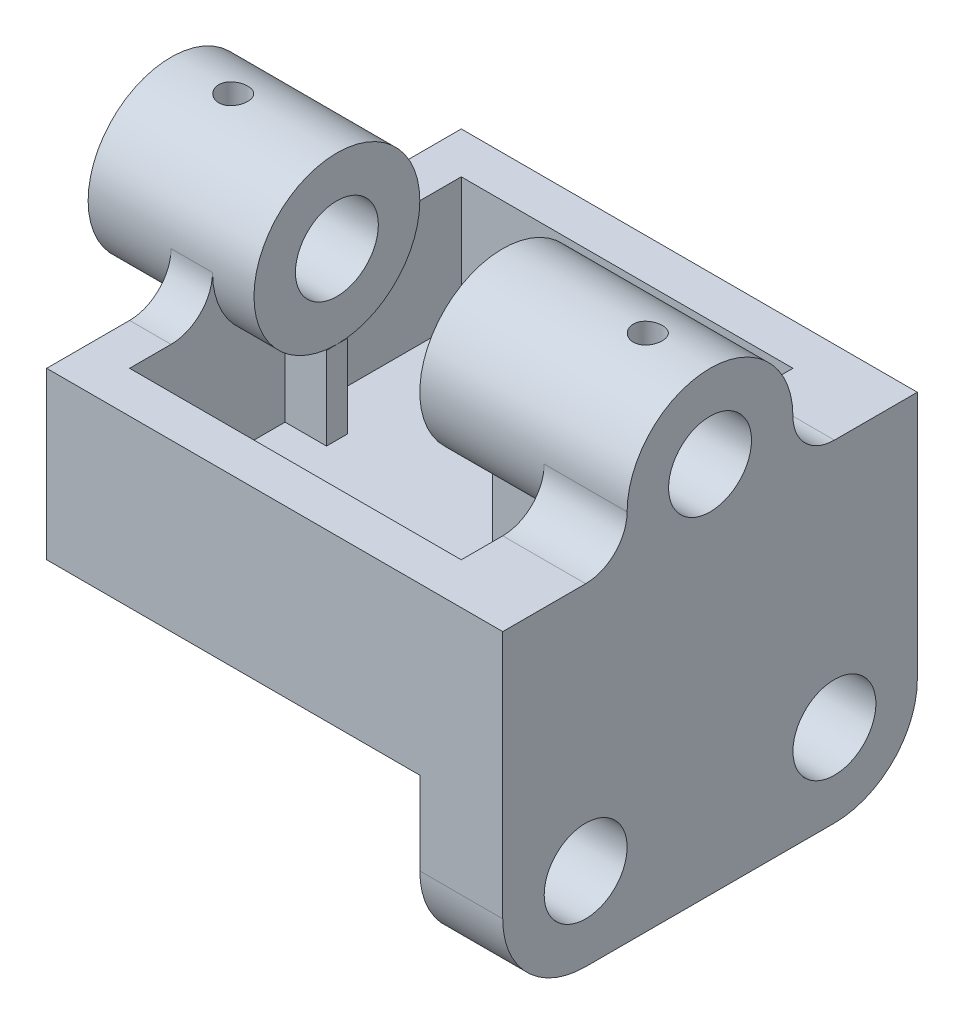
from build123d import *
from build123d.topology import SkipClean

# Parameters (mm, degrees)
SKETCH1_W                = 120
SKETCH1_H                = 100
BOSS_EXTRUDE1_DEPTH      = 100
CUT_EXTRUDE2_DEPTH       = 135
SKETCH3_W                = 20
SKETCH3_H                = 20
CUT_EXTRUDE3_DEPTH       = 135
CUT_EXTRUDE4_DEPTH       = 135
SKETCH5_R                = 20
BOSS_EXTRUDE2_DEPTH      = 120
BOSS_EXTRUDE3_START      = 10
SKETCH6_R                = 20
BOSS_EXTRUDE3_DEPTH      = 10
SKETCH7_R                = 10
CUT_EXTRUDE5_DEPTH       = 40
SKETCH8_R                = 20
CUT_EXTRUDE6_DEPTH       = 40
SKETCH9_R                = 10
CUT_EXTRUDE7_DEPTH       = 76
SKETCH10_R               = 3.5
CUT_EXTRUDE8_DEPTH       = 154
BOSS_EXTRUDE5_DEPTH      = 40
BOSS_EXTRUDE6_START      = -50.0000001
BOSS_EXTRUDE6_DEPTH      = 50.0000001
SKETCH13_R               = 3.5
BOSS_EXTRUDE7_DEPTH      = 50
SKETCH15_R               = 10
CUT_EXTRUDE11_DEPTH      = 152
CUT_EXTRUDE14_DEPTH      = 152
CUT_EXTRUDE14_DEPTH_BACK = 30
SKETCH16_OUTSIDE_W       = 171.496
SKETCH16_OUTSIDE_H       = 141.496
SKETCH16_OUTSIDE_W_2     = 90
SKETCH16_OUTSIDE_H_2     = 80
BOSS_EXTRUDE8_START      = 20
SKETCH17_R               = 20
SKETCH17_R_2             = 10
BOSS_EXTRUDE8_DEPTH      = 20
SKETCH18_R               = 20
SKETCH18_R_2             = 10
BOSS_EXTRUDE9_DEPTH      = 20
SKETCH19_W               = 10
SKETCH19_H               = 30
BOSS_EXTRUDE10_DEPTH     = 90
SKETCH20_W               = 90
SKETCH20_H               = 30
BOSS_EXTRUDE11_DEPTH     = 10
SKETCH22_W               = 100
SKETCH22_H               = 10
CUT_EXTRUDE15_DEPTH      = 10
SKETCH23_W               = 100
SKETCH23_H               = 10
CUT_EXTRUDE16_DEPTH      = 20
CUT_EXTRUDE19_START      = -20
CUT_EXTRUDE19_DEPTH      = 20
SKETCH25_R               = 3.5
CUT_EXTRUDE20_DEPTH      = 220
SKETCH26_R               = 3.5
BOSS_EXTRUDE15_DEPTH     = 85
CUT_EXTRUDE21_START      = 85
CUT_EXTRUDE21_DEPTH      = 85
CUT_EXTRUDE22_DEPTH      = 85
SKETCH30_W               = 90
SKETCH30_H               = 10
CUT_EXTRUDE23_DEPTH      = 85
CUT_EXTRUDE24_START      = -149
SKETCH31_R               = 10
CUT_EXTRUDE24_DEPTH      = 149
SKETCH34_W               = 10
SKETCH34_H               = 39.999
CUT_EXTRUDE33_DEPTH      = 30
SKETCH35_W               = 50
SKETCH35_H               = 10
CUT_EXTRUDE34_DEPTH      = 40
SKETCH36_W               = 112.854184332
SKETCH36_H               = 51.466709558
CUT_EXTRUDE35_DEPTH      = 100
CUT_EXTRUDE36_DEPTH      = 90
BOSS_EXTRUDE16_REACH     = 173.828
SKETCH38_W               = 20
SKETCH38_H               = 40
BOSS_EXTRUDE17_DEPTH     = 20
SKETCH40_W               = 50
SKETCH40_H               = 10
BOSS_EXTRUDE18_DEPTH     = 40
CHAMFER1_SIZE            = 50
CHAMFER1_SIZE_2          = 40
SKETCH41_W               = 10
SKETCH41_H               = 20
BOSS_EXTRUDE21_DEPTH     = 2.5
SKETCH41_W_2             = 30
BOSS_EXTRUDE21_2_DEPTH   = 2.5


with BuildPart() as part:
    # Sketch1 → Boss-Extrude1 (new body)
    with BuildSketch(Plane(origin=(0, 0, 0), x_dir=(1, 0, 0), z_dir=(0, 1, 0))):
        with Locations((60, 50)):
            Rectangle(SKETCH1_W, SKETCH1_H)
    extrude(amount=BOSS_EXTRUDE1_DEPTH)

    # Sketch2 → Cut-Extrude2 (cut)
    with BuildSketch(Plane(origin=(0, 0, 0), x_dir=(0, 0, -1), z_dir=(1, 0, 0))):
        with BuildLine():
            Line((80, 0), (100, 0))
            Line((100, 0), (100, 20))
            ThreePointArc((100, 20), (94.142135624, 5.857864376), (80, 0))
        make_face()
        with BuildLine():
            Line((0, 0), (20, 0))
            ThreePointArc((20, 0), (5.857864376, 5.857864376), (0, 20))
            Line((0, 20), (0, 0))
        make_face()
    extrude(amount=CUT_EXTRUDE2_DEPTH, mode=Mode.SUBTRACT)

    # Sketch3 → Cut-Extrude3 (cut)
    with BuildSketch(Plane.ZY):
        with Locations((-90, 90)):
            Rectangle(SKETCH3_W, SKETCH3_H)
        with Locations((-10, 90)):
            Rectangle(SKETCH3_W, SKETCH3_H)
    extrude(amount=-CUT_EXTRUDE3_DEPTH, mode=Mode.SUBTRACT)

    # Sketch4 → Cut-Extrude4 (cut)
    with BuildSketch(Plane.ZY):
        with BuildLine():
            Line((-80, 100), (-80, 80))
            ThreePointArc((-80, 80), (-72.928932188, 82.928932188), (-70, 90))
            ThreePointArc((-70, 90), (-69.318516526, 95.176380902), (-67.320508076, 100))
            Line((-67.320508076, 100), (-80, 100))
        make_face()
        with BuildLine():
            ThreePointArc((-32.679491924, 100), (-30.681483474, 95.176380902), (-30, 90))
            ThreePointArc((-30, 90), (-27.071067812, 82.928932188), (-20, 80))
            Line((-20, 80), (-20, 100))
            Line((-20, 100), (-32.679491924, 100))
        make_face()
    extrude(amount=-CUT_EXTRUDE4_DEPTH, mode=Mode.SUBTRACT)

    # Sketch5 → Boss-Extrude2 (add)
    with SkipClean():  # the faces are left unmerged after this step: merging them gives an invalid solid
        with BuildSketch(Plane.ZY):
            with Locations((-50, 90)):
                Circle(SKETCH5_R)
        extrude(amount=-BOSS_EXTRUDE2_DEPTH)

    # Sketch6 → Boss-Extrude3 (add)
    with SkipClean():  # the faces are left unmerged after this step: merging them gives an invalid solid
        with BuildSketch(Plane.ZY.offset(BOSS_EXTRUDE3_START)):
            with Locations((-50, 90)):
                Circle(SKETCH6_R)
        extrude(amount=-BOSS_EXTRUDE3_DEPTH)

    # Sketch7 → Cut-Extrude5 (cut)
    with SkipClean():  # the faces are left unmerged after this step: merging them gives an invalid solid
        with BuildSketch(Plane.ZY.offset(10)):
            with Locations((-50, 90)):
                Circle(SKETCH7_R)
        extrude(amount=-CUT_EXTRUDE5_DEPTH, mode=Mode.SUBTRACT)

    # Sketch8 → Cut-Extrude6 (cut)
    with SkipClean():  # the faces are left unmerged after this step: merging them gives an invalid solid
        with BuildSketch(Plane(origin=(30, 0, 0), x_dir=(0, 0, -1), z_dir=(1, 0, 0))):
            with Locations(Location((50, 90, 0), (0, 0, 180))):
                Circle(SKETCH8_R)
        extrude(amount=CUT_EXTRUDE6_DEPTH, mode=Mode.SUBTRACT)

    # Sketch9 → Cut-Extrude7 (cut)
    with SkipClean():  # the faces are left unmerged after this step: merging them gives an invalid solid
        with BuildSketch(Plane.ZY.offset(-70)):
            with Locations((-50, 90)):
                Circle(SKETCH9_R)
        extrude(amount=-CUT_EXTRUDE7_DEPTH, mode=Mode.SUBTRACT)

    # Sketch10 → Cut-Extrude8 (cut)
    with SkipClean():  # the faces are left unmerged after this step: merging them gives an invalid solid
        with BuildSketch(Plane(origin=(0, 0, 0), x_dir=(1, 0, 0), z_dir=(0, 1, 0))):
            with Locations(Location((5, 50, 0), (0, 0, 90))):
                Circle(SKETCH10_R)
            with Locations(Location((105, 50, 0), (0, 0, 90))):
                Circle(SKETCH10_R)
        extrude(amount=CUT_EXTRUDE8_DEPTH, mode=Mode.SUBTRACT)

    # Sketch11 → Boss-Extrude5 (add)
    with SkipClean():  # the faces are left unmerged after this step: merging them gives an invalid solid
        with BuildSketch(Plane.ZY.offset(10)):
            with BuildLine():
                ThreePointArc((-40, 90), (-50, 80), (-60, 90))
                Line((-60, 90), (-70, 90))
                ThreePointArc((-70, 90), (-50, 70), (-30, 90))
                Line((-30, 90), (-40, 90))
            make_face()
        extrude(amount=-BOSS_EXTRUDE5_DEPTH)
    add(part.part.scale(1), mode=Mode.REPLACE)  # the faces are merged on a copy

    # Boss-Extrude6: read off the stored shape, not the designer's step
    # Boss-Extrude6 outline → Boss-Extrude6 (add)
    with BuildSketch(Plane.ZY.offset(-70).offset(BOSS_EXTRUDE6_START)):
        with BuildLine():
            Line((-30, 90), (-40, 90))
            ThreePointArc((-40, 90), (-50, 80), (-60, 90))
            Line((-60, 90), (-70, 90))
            ThreePointArc((-70, 90), (-65.329710362, 77.154768192), (-53.500001979, 70.308631684))
            ThreePointArc((-53.500001979, 70.308631684), (-49.999509114, 70.000000006), (-46.499031404, 70.308803518))
            ThreePointArc((-46.499031404, 70.308803518), (-34.669974365, 77.155144452), (-30, 90))
        make_face()
    extrude(amount=BOSS_EXTRUDE6_DEPTH)

    # Sketch13 → Boss-Extrude7 (add)
    with SkipClean():  # the faces are left unmerged after this step: merging them gives an invalid solid
        with BuildSketch(Plane.XZ):
            with Locations(Location((5, -50, 0), (0, 0, 270))):
                Circle(SKETCH13_R)
            with Locations(Location((105, -50, 0), (0, 0, 270))):
                Circle(SKETCH13_R)
        extrude(amount=-BOSS_EXTRUDE7_DEPTH)

    # Sketch15 → Cut-Extrude11 (cut)
    with SkipClean():  # the faces are left unmerged after this step: merging them gives an invalid solid
        with BuildSketch(Plane.ZY):
            with Locations((-80, 20)):
                Circle(SKETCH15_R)
            with Locations((-20, 20)):
                Circle(SKETCH15_R)
        extrude(amount=-CUT_EXTRUDE11_DEPTH, mode=Mode.SUBTRACT)

    # Sketch16 outside → Cut-Extrude14 (cut, two sides: drawn at the far end of the back side and taken through both)
    with SkipClean():  # the faces are left unmerged after this step: merging them gives an invalid solid
        with BuildSketch(Plane(origin=(0, 80, 0), x_dir=(1, 0, 0), z_dir=(0, 1, 0)).offset(-CUT_EXTRUDE14_DEPTH_BACK)):
            with Locations((55, 50)):
                Rectangle(SKETCH16_OUTSIDE_W, SKETCH16_OUTSIDE_H)
            with Locations((55, 50)):
                Rectangle(SKETCH16_OUTSIDE_W_2, SKETCH16_OUTSIDE_H_2, mode=Mode.SUBTRACT)
        extrude(amount=CUT_EXTRUDE14_DEPTH + CUT_EXTRUDE14_DEPTH_BACK, mode=Mode.SUBTRACT)

    # Sketch17 → Boss-Extrude8 (add)
    with SkipClean():  # the faces are left unmerged after this step: merging them gives an invalid solid
        with BuildSketch(Plane.ZY.offset(-10).offset(BOSS_EXTRUDE8_START)):
            with Locations((-50, 90)):
                Circle(SKETCH17_R)
            with Locations((-50, 90)):
                Circle(SKETCH17_R_2, mode=Mode.SUBTRACT)
        extrude(amount=-BOSS_EXTRUDE8_DEPTH)

    # Sketch18 → Boss-Extrude9 (add)
    with SkipClean():  # the faces are left unmerged after this step: merging them gives an invalid solid
        with BuildSketch(Plane(origin=(100, 0, 0), x_dir=(0, 0, -1), z_dir=(1, 0, 0))):
            with Locations(Location((50, 90, 0), (0, 0, 180))):
                Circle(SKETCH18_R)
            with Locations(Location((50, 90, 0), (0, 0, 180))):
                Circle(SKETCH18_R_2, mode=Mode.SUBTRACT)
        extrude(amount=BOSS_EXTRUDE9_DEPTH)

    # Sketch19 → Boss-Extrude10 (add)
    with SkipClean():  # the faces are left unmerged after this step: merging them gives an invalid solid
        with BuildSketch(Plane.ZY.offset(-10)):
            with Locations((-95, 65)):
                Rectangle(SKETCH19_W, SKETCH19_H)
        extrude(amount=-BOSS_EXTRUDE10_DEPTH)

    # Sketch20 → Boss-Extrude11 (add)
    with SkipClean():  # the faces are left unmerged after this step: merging them gives an invalid solid
        with BuildSketch(Plane.XY.offset(-10)):
            with Locations((55, 65)):
                Rectangle(SKETCH20_W, SKETCH20_H)
        extrude(amount=BOSS_EXTRUDE11_DEPTH)

    # Sketch22 → Cut-Extrude15 (cut)
    with SkipClean():  # the faces are left unmerged after this step: merging them gives an invalid solid
        with BuildSketch(Plane.ZY):
            with Locations((-50, 45)):
                Rectangle(SKETCH22_W, SKETCH22_H)
        extrude(amount=-CUT_EXTRUDE15_DEPTH, mode=Mode.SUBTRACT)

    # Sketch23 → Cut-Extrude16 (cut)
    with SkipClean():  # the faces are left unmerged after this step: merging them gives an invalid solid
        with BuildSketch(Plane(origin=(120, 0, 0), x_dir=(0, 0, -1), z_dir=(1, 0, 0))):
            with Locations((50, 45)):
                Rectangle(SKETCH23_W, SKETCH23_H)
        extrude(amount=-CUT_EXTRUDE16_DEPTH, mode=Mode.SUBTRACT)

    # Sketch24 → Cut-Extrude19 (cut)
    with SkipClean():  # the faces are left unmerged after this step: merging them gives an invalid solid
        with BuildSketch(Plane(origin=(100, 0, 0), x_dir=(0, 0, -1), z_dir=(1, 0, 0)).offset(CUT_EXTRUDE19_START)):
            with BuildLine():
                ThreePointArc((30, 90), (27.071067812, 82.928932188), (20, 80))
                Line((20, 80), (32.679491924, 80))
                ThreePointArc((32.679491924, 80), (30.681483474, 84.823619098), (30, 90))
            make_face()
            with BuildLine():
                ThreePointArc((70, 90), (69.318516526, 84.823619098), (67.320508076, 80))
                Line((67.320508076, 80), (80, 80))
                ThreePointArc((80, 80), (72.928932188, 82.928932188), (70, 90))
            make_face()
            with BuildLine():
                Line((20, 80), (10, 80))
                Line((10, 80), (10, 50))
                Line((10, 50), (90, 50))
                Line((90, 50), (90, 80))
                Line((90, 80), (80, 80))
                Line((80, 80), (67.320508076, 80))
                ThreePointArc((67.320508076, 80), (50, 70), (32.679491924, 80))
                Line((32.679491924, 80), (20, 80))
            make_face()
        extrude(amount=CUT_EXTRUDE19_DEPTH, mode=Mode.SUBTRACT)

    # Sketch25 → Cut-Extrude20 (cut)
    with SkipClean():  # the faces are left unmerged after this step: merging them gives an invalid solid
        with BuildSketch(Plane(origin=(0, 0, 0), x_dir=(1, 0, 0), z_dir=(0, 1, 0))):
            with Locations(Location((5, 50, 0), (0, 0, 90))):
                Circle(SKETCH25_R)
            with Locations(Location((105, 50, 0), (0, 0, 90))):
                Circle(SKETCH25_R)
        extrude(amount=CUT_EXTRUDE20_DEPTH, mode=Mode.SUBTRACT)

    # Sketch26 → Boss-Extrude15 (add)
    with SkipClean():  # the faces are left unmerged after this step: merging them gives an invalid solid
        with BuildSketch(Plane.XZ):
            with Locations(Location((5, -50, 0), (0, 0, 270))):
                Circle(SKETCH26_R)
            with Locations(Location((105, -50, 0), (0, 0, 270))):
                Circle(SKETCH26_R)
        extrude(amount=-BOSS_EXTRUDE15_DEPTH)

    # Sketch27 → Cut-Extrude21 (cut)
    with SkipClean():  # the faces are left unmerged after this step: merging them gives an invalid solid
        with BuildSketch(Plane.ZY.offset(-10).offset(CUT_EXTRUDE21_START)):
            with BuildLine():
                Line((-70, 90), (-70, 39.958071387))
                Line((-70, 39.958071387), (-30, 40))
                Line((-30, 40), (-30, 90))
                ThreePointArc((-30, 90), (-50, 70), (-70, 90))
            make_face()
        extrude(amount=-CUT_EXTRUDE21_DEPTH, mode=Mode.SUBTRACT)
    add(part.part.scale(1), mode=Mode.REPLACE)  # the faces are merged on a copy

    # Sketch29 → Cut-Extrude22 (cut)
    with BuildSketch(Plane(origin=(80, 0, 0), x_dir=(0, 0, -1), z_dir=(1, 0, 0))):
        with BuildLine():
            Line((30, 90), (30, 50))
            Line((30, 50), (70, 50))
            Line((70, 50), (70, 90))
            ThreePointArc((70, 90), (50, 70), (30, 90))
        make_face()
    extrude(amount=CUT_EXTRUDE22_DEPTH, mode=Mode.SUBTRACT)

    # Sketch30 → Cut-Extrude23 (cut)
    with BuildSketch(Plane(origin=(100, 0, 0), x_dir=(0, 0, -1), z_dir=(1, 0, 0))):
        with Locations((55, 45)):
            Rectangle(SKETCH30_W, SKETCH30_H)
    extrude(amount=CUT_EXTRUDE23_DEPTH, mode=Mode.SUBTRACT)

    # Sketch31 → Cut-Extrude24 (cut)
    with BuildSketch(Plane(origin=(120, 0, 0), x_dir=(0, 0, -1), z_dir=(1, 0, 0)).offset(CUT_EXTRUDE24_START)):
        with Locations(Location((50, 90, 0), (0, 0, 180))):
            Circle(SKETCH31_R)
    extrude(amount=CUT_EXTRUDE24_DEPTH, mode=Mode.SUBTRACT)

    # Sketch34 → Cut-Extrude33 (cut)
    with BuildSketch(Plane.ZY):
        with Locations((-50, 19.9995)):
            Rectangle(SKETCH34_W, SKETCH34_H)
    extrude(amount=-CUT_EXTRUDE33_DEPTH, mode=Mode.SUBTRACT)

    # Sketch35 → Cut-Extrude34 (cut)
    with BuildSketch(Plane.XZ):
        with Locations((95, -50)):
            Rectangle(SKETCH35_W, SKETCH35_H)
    extrude(amount=-CUT_EXTRUDE34_DEPTH, mode=Mode.SUBTRACT)

    # Sketch36 → Cut-Extrude35 (cut)
    with BuildSketch(Plane.ZY):
        with Locations((-43.572907834, 14.266645221)):
            Rectangle(SKETCH36_W, SKETCH36_H)
    extrude(amount=-CUT_EXTRUDE35_DEPTH, mode=Mode.SUBTRACT)


with BuildPart() as cut_extrude35_piece_1:
    # of the separate pieces the step leaves, piece 1, a body of its own (cut_extrude35_pieces)
    add(part.part.solids().sort_by_distance((100, 80, 0))[0])

    # Sketch37 → Cut-Extrude36 (cut)
    with SkipClean():  # the faces are left unmerged after this step: merging them gives an invalid solid
        with BuildSketch(Plane(origin=(20, 0, 0), x_dir=(0, 0, -1), z_dir=(1, 0, 0))):
            with BuildLine():
                Line((90, 80), (80, 80))
                ThreePointArc((80, 80), (72.928932188, 82.928932188), (70, 90))
                ThreePointArc((70, 90), (50, 70), (30, 90))
                ThreePointArc((30, 90), (27.071067812, 82.928932188), (20, 80))
                Line((20, 80), (10, 80))
                Line((10, 80), (10, 50))
                Line((10, 50), (90, 50))
                Line((90, 50), (90, 80))
            make_face()
        extrude(amount=CUT_EXTRUDE36_DEPTH, mode=Mode.SUBTRACT)


with BuildPart() as cut_extrude35_piece_2:
    # of the separate pieces the step leaves, piece 2, a body of its own (cut_extrude35_pieces)
    add(part.part.solids().sort_by_distance((120, 40, -55))[0])

    # Sketch38 → Boss-Extrude16 (add, up to next)
    with BuildSketch(Plane(origin=(0, 0, -45), x_dir=(-1, 0, 0), z_dir=(0, 0, -1)), mode=Mode.PRIVATE) as boss_extrude16_sk1:
        with Locations((-110, 20)):
            Rectangle(SKETCH38_W, SKETCH38_H)
    boss_extrude16_tool1 = extrude(boss_extrude16_sk1.sketch, amount=BOSS_EXTRUDE16_REACH, mode=Mode.PRIVATE) - cut_extrude35_piece_2.part


with BuildPart() as cut_extrude35_piece_3:
    # of the separate pieces the step leaves, piece 3, a body of its own (cut_extrude35_pieces)
    add(part.part.solids().sort_by_distance((100, 20, 0))[0])


with BuildPart() as cut_extrude36_piece_1:
    # of the separate pieces the step leaves, piece 1, a body of its own (cut_extrude36_pieces)
    add(cut_extrude35_piece_1.part.solids().sort_by_distance((100, 40, 0))[0])


with BuildPart() as cut_extrude36_piece_2:
    # of the separate pieces the step leaves, piece 2, a body of its own (cut_extrude36_pieces)
    add(cut_extrude35_piece_1.part.solids().sort_by_distance((80, 90, -30))[0])


with BuildPart() as cut_extrude35_piece_2_1:
    add(cut_extrude35_piece_2.part)

    add(cut_extrude35_piece_3.part)  # Boss-Extrude16 merges Cut-Extrude35 piece 3
    add(boss_extrude16_tool1.solids().sort_by_distance((110, 20, -45))[0])


    with SkipClean():  # the faces are left unmerged after this step: merging them gives an invalid solid
        add(cut_extrude36_piece_1.part)  # Boss-Extrude17 merges Cut-Extrude36 piece 1

        add(cut_extrude36_piece_2.part)  # Boss-Extrude17 merges Cut-Extrude36 piece 2
        # Sketch39 → Boss-Extrude17 (add)
        with BuildSketch(Plane(origin=(100, 0, 0), x_dir=(0, 0, -1), z_dir=(1, 0, 0))):
            with BuildLine():
                ThreePointArc((30, 90), (27.071067812, 82.928932188), (20, 80))
                Line((20, 80), (10, 80))
                Line((10, 80), (10, 50))
                Line((10, 50), (90, 50))
                Line((90, 50), (90, 80))
                Line((90, 80), (80, 80))
                ThreePointArc((80, 80), (72.928932188, 82.928932188), (70, 90))
                ThreePointArc((70, 90), (50, 70), (30, 90))
            make_face()
            Polygon((90, 80), (90, 50), (10, 50), (10, 80), (0, 80), (0, 40), (100, 40), (100, 80), align=None)
        extrude(amount=BOSS_EXTRUDE17_DEPTH)

    # Sketch40 → Boss-Extrude18 (add)
    with SkipClean():  # the faces are left unmerged after this step: merging them gives an invalid solid
        with BuildSketch(Plane.XZ.offset(-40)):
            with Locations((75, -50)):
                Rectangle(SKETCH40_W, SKETCH40_H)
        extrude(amount=BOSS_EXTRUDE18_DEPTH)

    # Chamfer1
    # the kernel refuses this chamfer: 50, 40 mm, written as the material it takes off along each edge
    with BuildSketch(Plane(origin=(50, 0, 83.942180887), x_dir=(1, 0, 0), z_dir=(0, 0, -1))) as chamfer1_piece_1:
        Polygon((CHAMFER1_SIZE, 0), (0, -CHAMFER1_SIZE_2), (0, 0), align=None)
    extrude(amount=267.884361773, mode=Mode.SUBTRACT)


with BuildPart() as body_2:
    # Sketch41 → Boss-Extrude21 (new, symmetric)
    with BuildSketch(Plane.XY.offset(-50)):
        with Locations((25, 60)):
            Rectangle(SKETCH41_W, SKETCH41_H)
    extrude(amount=BOSS_EXTRUDE21_DEPTH, both=True)


with BuildPart() as body_3:
    # Sketch41 → Boss-Extrude21 2 (new, symmetric)
    with BuildSketch(Plane.XY.offset(-50)):
        with Locations((85, 60)):
            Rectangle(SKETCH41_W_2, SKETCH41_H)
    extrude(amount=BOSS_EXTRUDE21_2_DEPTH, both=True)


solid = Compound([cut_extrude35_piece_2_1.part, body_2.part, body_3.part])
